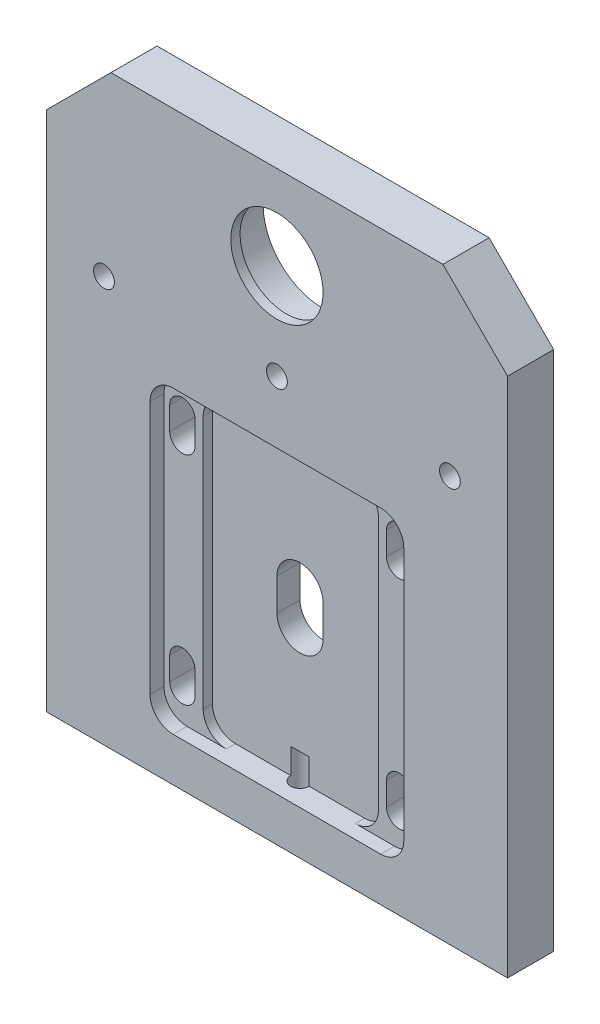
from build123d import *

# Parameters (mm, degrees)
ESTRUSIONE_ESTRUSIONE1_DEPTH = 10
SCHIZZO2_R                   = 10
TAGLIO_ESTRUSIONE1_DEPTH     = 10
SCHIZZO3_R                   = 2.25
TAGLIO_ESTRUSIONE2_DEPTH     = 10
TAGLIO_ESTRUSIONE3_DEPTH     = 3
TAGLIO_ESTRUSIONE4_DEPTH     = 2
TAGLIO_ESTRUSIONE5_DEPTH     = 162.721983663
TAGLIO_ESTRUSIONE6_DEPTH     = 162.796168063
SCHIZZO8_R                   = 13
TAGLIO_ESTRUSIONE7_DEPTH     = 8
SCHIZZO9_R                   = 4
TAGLIO_ESTRUSIONE8_DEPTH     = 4
SCHIZZO10_R                  = 2
TAGLIO_ESTRUSIONE9_DEPTH     = 15


with BuildPart() as part:
    # Schizzo1 → Estrusione-Estrusione1 (new body)
    with BuildSketch(Plane.XY):
        Polygon((0, 113), (14, 127), (86, 127), (100, 113), (100, 0), (0, 0), align=None)
    extrude(amount=-ESTRUSIONE_ESTRUSIONE1_DEPTH)

    # Schizzo2 → Taglio-Estrusione1 (cut)
    with BuildSketch(Plane.XY):
        with Locations((50, 108.7)):
            Circle(SCHIZZO2_R)
    extrude(amount=-TAGLIO_ESTRUSIONE1_DEPTH, mode=Mode.SUBTRACT)

    # Schizzo3 → Taglio-Estrusione2 (cut)
    with BuildSketch(Plane.XY):
        with Locations((12.5, 88)):
            Circle(SCHIZZO3_R)
        with Locations((50, 88)):
            Circle(SCHIZZO3_R)
        with Locations((87.5, 88)):
            Circle(SCHIZZO3_R)
    extrude(amount=-TAGLIO_ESTRUSIONE2_DEPTH, mode=Mode.SUBTRACT)

    # Schizzo4 → Taglio-Estrusione3 (cut)
    with BuildSketch(Plane.XY):
        with BuildLine():
            Line((27.5, 74.5), (72.5, 74.5))
            ThreePointArc((72.5, 74.5), (76.035533906, 73.035533906), (77.5, 69.5))
            Line((77.5, 69.5), (77.5, 14.5))
            ThreePointArc((77.5, 14.5), (76.035533906, 10.964466094), (72.5, 9.5))
            Line((72.5, 9.5), (27.5, 9.5))
            ThreePointArc((27.5, 9.5), (23.964466094, 10.964466094), (22.5, 14.5))
            Line((22.5, 14.5), (22.5, 69.5))
            ThreePointArc((22.5, 69.5), (23.964466094, 73.035533906), (27.5, 74.5))
        make_face()
    extrude(amount=-TAGLIO_ESTRUSIONE3_DEPTH, mode=Mode.SUBTRACT)

    # Schizzo5 → Taglio-Estrusione4 (cut)
    with BuildSketch(Plane.XY.offset(-3)):
        with BuildLine():
            Line((36, 74.5), (64, 74.5))
            ThreePointArc((64, 74.5), (67.535533906, 73.035533906), (69, 69.5))
            Line((69, 69.5), (69, 14.5))
            ThreePointArc((69, 14.5), (67.535533906, 10.964466094), (64, 9.5))
            Line((64, 9.5), (36, 9.5))
            ThreePointArc((36, 9.5), (32.464466094, 10.964466094), (31, 14.5))
            Line((31, 14.5), (31, 69.5))
            ThreePointArc((31, 69.5), (32.464466094, 73.035533906), (36, 74.5))
        make_face()
    extrude(amount=-TAGLIO_ESTRUSIONE4_DEPTH, mode=Mode.SUBTRACT)

    # Schizzo6 → Taglio-Estrusione5 (cut, through all)
    with BuildSketch(Plane.XY.offset(-5)):
        with BuildLine():
            Line((54.993239352, 45.5), (54.993239352, 38.5))
            ThreePointArc((54.993239352, 38.5), (50, 33.506760648), (45.006760648, 38.5))
            Line((45.006760648, 38.5), (45.006760648, 45.5))
            ThreePointArc((45.006760648, 45.5), (50, 50.493239352), (54.993239352, 45.5))
        make_face()
    extrude(amount=-TAGLIO_ESTRUSIONE5_DEPTH, mode=Mode.SUBTRACT)

    # Schizzo7 → Taglio-Estrusione6 (cut, through all)
    with BuildSketch(Plane.XY.offset(-3)):
        with BuildLine():
            Line((23.75, 63), (23.75, 68))
            ThreePointArc((23.75, 68), (26.5, 70.75), (29.25, 68))
            Line((29.25, 68), (29.25, 63))
            ThreePointArc((29.25, 63), (26.5, 60.25), (23.75, 63))
        make_face()
        with BuildLine():
            Line((70.75, 63), (70.75, 68))
            ThreePointArc((70.75, 68), (73.5, 70.75), (76.25, 68))
            Line((76.25, 68), (76.25, 63))
            ThreePointArc((76.25, 63), (73.5, 60.25), (70.75, 63))
        make_face()
        with BuildLine():
            Line((23.75, 16), (23.75, 21))
            ThreePointArc((23.75, 21), (26.5, 23.75), (29.25, 21))
            Line((29.25, 21), (29.25, 16))
            ThreePointArc((29.25, 16), (26.5, 13.25), (23.75, 16))
        make_face()
        with BuildLine():
            Line((70.75, 16), (70.75, 21))
            ThreePointArc((70.75, 21), (73.5, 23.75), (76.25, 21))
            Line((76.25, 21), (76.25, 16))
            ThreePointArc((76.25, 16), (73.5, 13.25), (70.75, 16))
        make_face()
    extrude(amount=-TAGLIO_ESTRUSIONE6_DEPTH, mode=Mode.SUBTRACT)

    # Schizzo8 → Taglio-Estrusione7 (cut)
    with BuildSketch(Plane(origin=(0, 0, -10), x_dir=(-1, 0, 0), z_dir=(0, 0, -1))):
        with Locations((-50, 108.7)):
            Circle(SCHIZZO8_R)
    extrude(amount=-TAGLIO_ESTRUSIONE7_DEPTH, mode=Mode.SUBTRACT)

    # Schizzo9 → Taglio-Estrusione8 (cut)
    with BuildSketch(Plane(origin=(0, 0, -10), x_dir=(-1, 0, 0), z_dir=(0, 0, -1))):
        with Locations((-85, 83)):
            Circle(SCHIZZO9_R)
        with Locations((-50, 88)):
            Circle(SCHIZZO9_R)
        with Locations((-12.5, 88)):
            Circle(SCHIZZO9_R)
    extrude(amount=-TAGLIO_ESTRUSIONE8_DEPTH, mode=Mode.SUBTRACT)

    # Schizzo10 → Taglio-Estrusione9 (cut)
    with BuildSketch(Plane.XZ):
        with Locations((50, -5)):
            Circle(SCHIZZO10_R)
        with Locations((19.5, -5)):
            Circle(SCHIZZO10_R)
        with Locations((80.5, -5)):
            Circle(SCHIZZO10_R)
    extrude(amount=-TAGLIO_ESTRUSIONE9_DEPTH, mode=Mode.SUBTRACT)


solid = part.part
